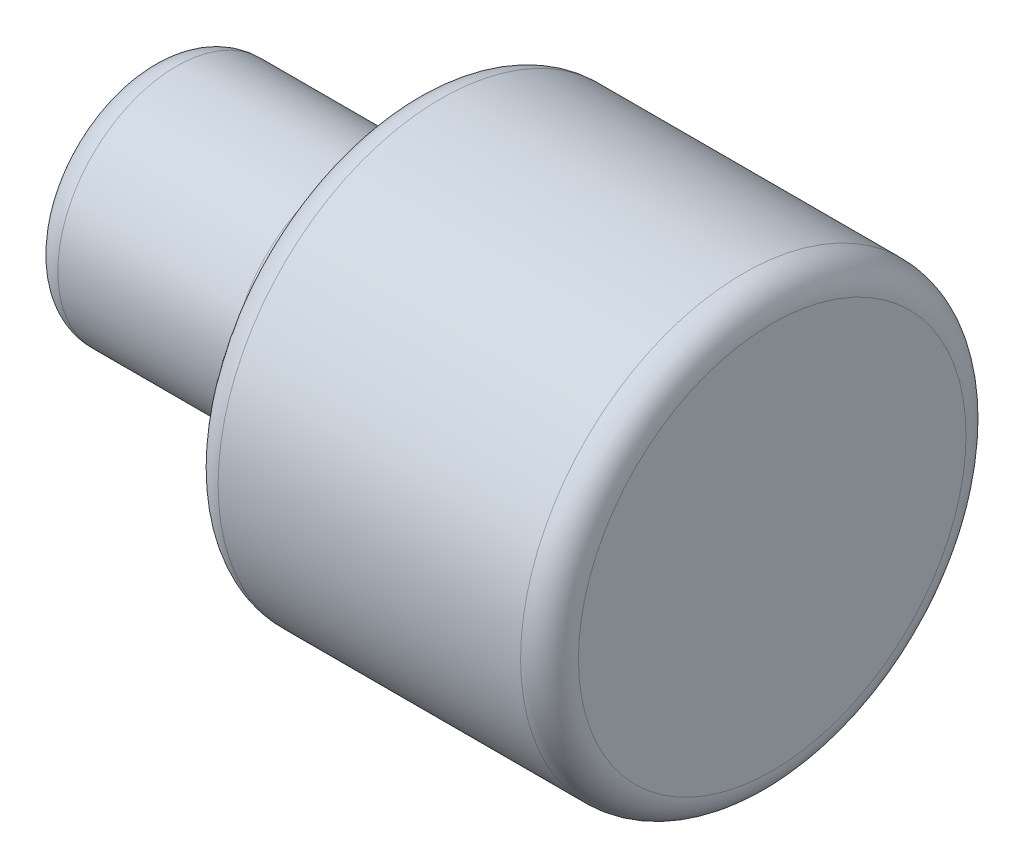
from build123d import *

# Parameters (mm, degrees)
CROQUIS1_R              = 3.85
CROQUIS1_R_2            = 2.05
SALIENTE_EXTRUIR1_DEPTH = 6
CROQUIS1_3_R            = 2.05
SALIENTE_EXTRUIR2_DEPTH = 4.8
CHAFL_N1_SIZE           = 1.85
CHAFL_N1_SIZE_2         = 1
REDONDEO1_R             = 0.5


with BuildPart() as part:
    # Croquis1 → Saliente-Extruir1 (new body)
    # profile 1 of 2: a face of its own
    with BuildSketch(Plane.YZ):
        with Locations(Location((0, 0, 0), (0, 0, 270))):
            Circle(CROQUIS1_R)
        Circle(CROQUIS1_R_2, mode=Mode.SUBTRACT)
    # profile 2 of 2: a face of its own
    with BuildSketch(Plane.YZ):
        Circle(CROQUIS1_R_2)
    extrude(amount=SALIENTE_EXTRUIR1_DEPTH)

    # Croquis1<3> → Saliente-Extruir2 (add)
    with BuildSketch(Plane.YZ):
        with Locations(Location((0, 0, 0), (0, 0, 270))):
            Circle(CROQUIS1_3_R)
    extrude(amount=-SALIENTE_EXTRUIR2_DEPTH)

    # Chaflán1
    # the kernel refuses this chamfer: 1.85, 1 mm, written as the material it adds along each edge
    with BuildSketch(Plane(origin=(0, 0, 0), x_dir=(0, 0, -1), z_dir=(0, -1, 0))) as chafl_n1_piece_1_section:
        Polygon((2.05 + CHAFL_N1_SIZE, 0), (2.05, -CHAFL_N1_SIZE_2), (2.05, 0), align=None)
    chafl_n1_piece_1 = revolve(axis=Axis((0, 0, 0), (1, 0, 0)), mode=Mode.PRIVATE)
    chafl_n1_piece_1 = chafl_n1_piece_1 & Plane(origin=(-0.508255833, 0, 0), x_dir=(0, 0, -1), z_dir=(-1, 0, 0)) * Cylinder(3.85, 16, mode=Mode.PRIVATE)
    add(chafl_n1_piece_1)

    # Redondeo1
    redondeo1_edges = [part.edges().sort_by_distance(p)[0] for p in [
        (-1, 0, 2.05),
        (-0.027027027, 0, 3.85),
        (6, 0, 3.85),
        (-4.8, 0, 2.05),
    ]]
    fillet(redondeo1_edges, radius=REDONDEO1_R)


solid = part.part
